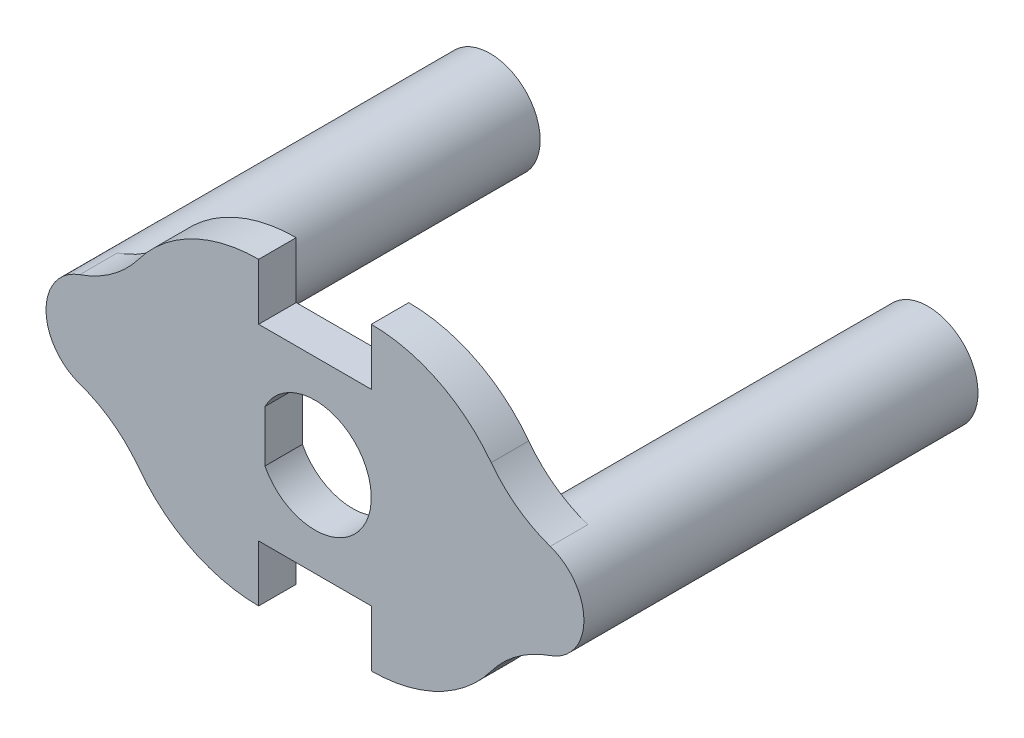
from build123d import *
from build123d.topology import SkipClean

# Parameters (mm, degrees)
EXTRUDE_1_DEPTH          = 1.5
CUT_EXTRUDE_1_DEPTH      = 25.80423351
SKETCH_5_R               = 4
EXTRUDE_2_DEPTH          = 28.5
SKETCH_8_R               = 1.5
CUT_EXTRUDE_2_DEPTH      = 10.5
CUT_EXTRUDE_3_DEPTH      = 6
CUT_EXTRUDE_3_DEPTH_BACK = 9
SKETCH_14_R              = 1.5
CUT_EXTRUDE_4_DEPTH      = 5


with BuildPart() as part:
    # 草图1 → 凸台-拉伸1 (new, symmetric)
    with BuildSketch(Plane.XY):
        with BuildLine():
            Line((-4.5, 7.5), (4.5, 7.5))
            Line((4.5, 7.5), (4.5, 12))
            ThreePointArc((4.5, 12), (9.857189903, 10.7378078), (14.087412587, 7.216752724))
            ThreePointArc((14.087412587, 7.216752724), (16.191153731, 5.146301215), (18.807692308, 3.780203808))
            ThreePointArc((18.807692308, 3.780203808), (21.5, 0), (18.807692308, -3.780203808))
            ThreePointArc((18.807692308, -3.780203808), (16.191153731, -5.146301215), (14.087412587, -7.216752724))
            ThreePointArc((14.087412587, -7.216752724), (9.857189903, -10.7378078), (4.5, -12))
            Line((4.5, -12), (4.5, -7.5))
            Line((4.5, -7.5), (-4.5, -7.5))
            Line((-4.5, -7.5), (-4.5, -12))
            ThreePointArc((-4.5, -12), (-9.857189903, -10.7378078), (-14.087412587, -7.216752724))
            ThreePointArc((-14.087412587, -7.216752724), (-16.191153731, -5.146301215), (-18.807692308, -3.780203808))
            ThreePointArc((-18.807692308, -3.780203808), (-21.5, 0), (-18.807692308, 3.780203808))
            ThreePointArc((-18.807692308, 3.780203808), (-16.191153731, 5.146301215), (-14.087412587, 7.216752724))
            ThreePointArc((-14.087412587, 7.216752724), (-9.857189903, 10.7378078), (-4.5, 12))
            Line((-4.5, 12), (-4.5, 7.5))
        make_face()
    extrude(amount=EXTRUDE_1_DEPTH, both=True)

    # 草图4 → 切除-拉伸1 (cut, through all)
    with BuildSketch(Plane.XY.offset(1.5)):
        with BuildLine():
            Line((-4, 2.061552813), (-4, -2.061552813))
            ThreePointArc((-4, -2.061552813), (4.5, 0), (-4, 2.061552813))
        make_face()
    extrude(amount=-CUT_EXTRUDE_1_DEPTH, mode=Mode.SUBTRACT)

    # 草图5 → 凸台-拉伸2 (add)
    with BuildSketch(Plane(origin=(0, 0, -1.5), x_dir=(-1, 0, 0), z_dir=(0, 0, -1))):
        with Locations((-17.5, 0)):
            Circle(SKETCH_5_R)
    extrude_2 = extrude(amount=EXTRUDE_2_DEPTH)

    # 草图8 → 切除-拉伸2 (cut)
    with BuildSketch(Plane(origin=(0, 0, -30), x_dir=(-1, 0, 0), z_dir=(0, 0, -1))):
        with Locations((-17.5, 0)):
            Circle(SKETCH_8_R)
    cut_extrude_2 = extrude(amount=-CUT_EXTRUDE_2_DEPTH, mode=Mode.SUBTRACT)

    # 镜向2: 凸台-拉伸2, 切除-拉伸2 across plane
    with SkipClean():  # the faces are left unmerged after this step: merging them gives an invalid solid
        add(extrude_2.mirror(Plane(origin=(0, 0, 0), x_dir=(0, 0, 1), z_dir=(1, 0, 0))))
        add(cut_extrude_2.mirror(Plane(origin=(0, 0, 0), x_dir=(0, 0, 1), z_dir=(1, 0, 0))), mode=Mode.SUBTRACT)

    # 草图10 → 切除-拉伸3 (cut, two sides: drawn at the far end of the back side and taken through both)
    with SkipClean():  # the faces are left unmerged after this step: merging them gives an invalid solid
        with BuildSketch(Plane(origin=(0, 0, -15.5), x_dir=(-1, 0, 0), z_dir=(0, 0, -1)).offset(-CUT_EXTRUDE_3_DEPTH_BACK)):
            with BuildLine():
                Line((20.088409222, -3.049612713), (20.088409222, 3.049612713))
                ThreePointArc((20.088409222, 3.049612713), (21.5, 0), (20.088409222, -3.049612713))
            make_face()
        extrude(amount=CUT_EXTRUDE_3_DEPTH + CUT_EXTRUDE_3_DEPTH_BACK, mode=Mode.SUBTRACT)

    # 草图14 → 切除-拉伸4 (cut)
    with SkipClean():  # the faces are left unmerged after this step: merging them gives an invalid solid
        with BuildSketch(Plane.ZY.offset(20.088409222)):
            with Locations((-16.5, 0)):
                Circle(SKETCH_14_R)
            with Locations((-10.5, 0)):
                Circle(SKETCH_14_R)
        extrude(amount=-CUT_EXTRUDE_4_DEPTH, mode=Mode.SUBTRACT)


solid = part.part
